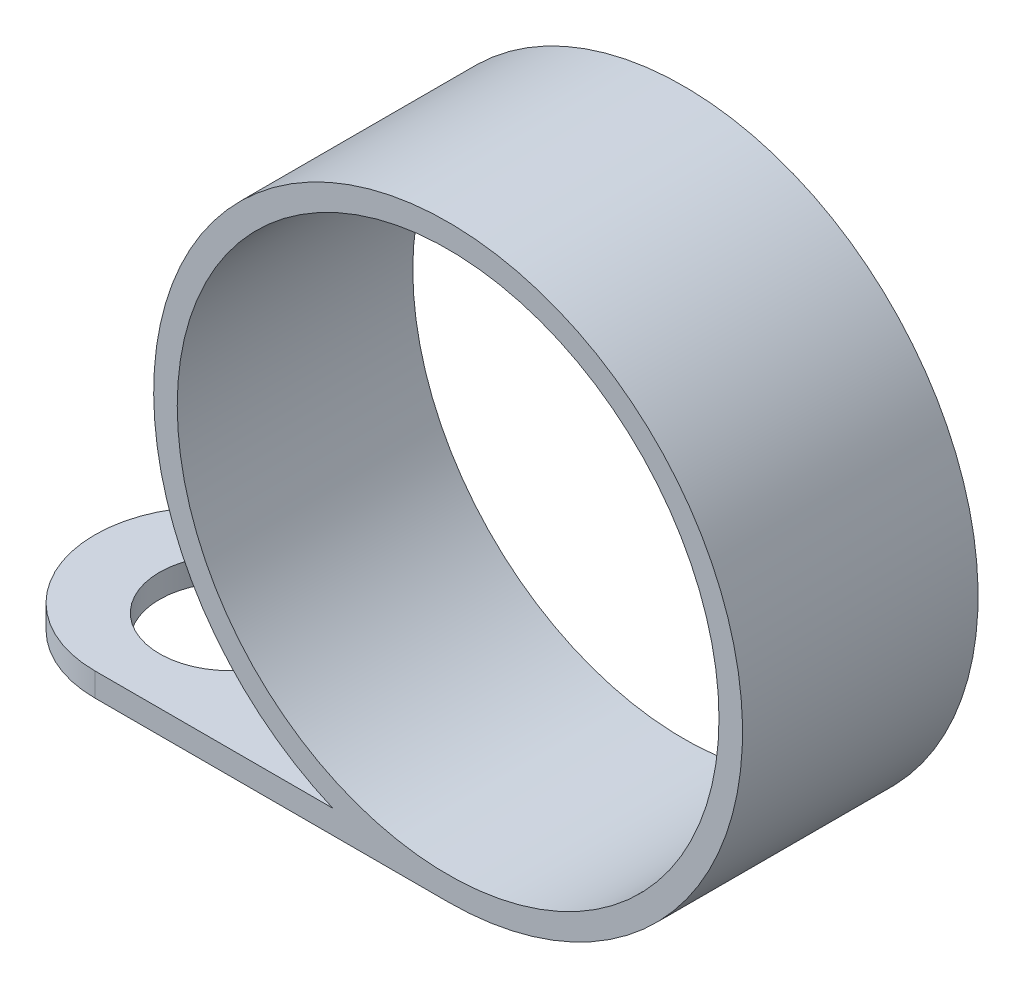
from build123d import *

# Parameters (mm, degrees)
SKETCH1_R           = 2.921
BOSS_EXTRUDE1_DEPTH = 2.54
SKETCH3_R           = 0.762
CUT_EXTRUDE1_DEPTH  = 0.254
FILLET1_R           = 1.27
SCALE1_SCALE        = 2.43
SCALE3_SCALE        = 1.15


with BuildPart() as part:
    # Sketch1 → Boss-Extrude1 (new body)
    with BuildSketch(Plane.XY):
        with BuildLine():
            Line((0, 0), (5.08, 0))
            ThreePointArc((5.08, 0), (5.715, 6.285851973), (3.835659211, 0.254))
            Line((3.835659211, 0.254), (0, 0.254))
            Line((0, 0.254), (0, 0))
        make_face()
        with Locations((5.08, 3.175)):
            Circle(SKETCH1_R, mode=Mode.SUBTRACT)
    extrude(amount=BOSS_EXTRUDE1_DEPTH)

    # Sketch3 → Cut-Extrude1 (cut)
    with BuildSketch(Plane(origin=(0, 0.254, 0), x_dir=(1, 0, 0), z_dir=(0, 1, 0))):
        with Locations(Location((1.4605, -1.27, 0), (0, 0, 180))):
            Circle(SKETCH3_R)
    extrude(amount=-CUT_EXTRUDE1_DEPTH, mode=Mode.SUBTRACT)

    # Fillet1
    fillet1_edges = [part.edges().sort_by_distance(p)[0] for p in [
        (0, 0.127, 2.54),
        (0, 0.127, 0),
    ]]
    fillet(fillet1_edges, radius=FILLET1_R - 0.0001)  # a hair under: the kernel refuses the full size


with BuildPart() as part_1:
    # Scale1: scaled about (4.695948506, 2.731518553, 1.27)
    add(part.part.scale(SCALE1_SCALE).moved(Location((-6.715206364, -3.906071531, -1.8161))))


with BuildPart() as part_2:
    # Scale3: scaled about (4.695948505, 2.731518554, 1.27)
    add(part_1.part.scale(SCALE3_SCALE).moved(Location((-0.704392276, -0.409727783, -0.1905))))


solid = part_2.part
